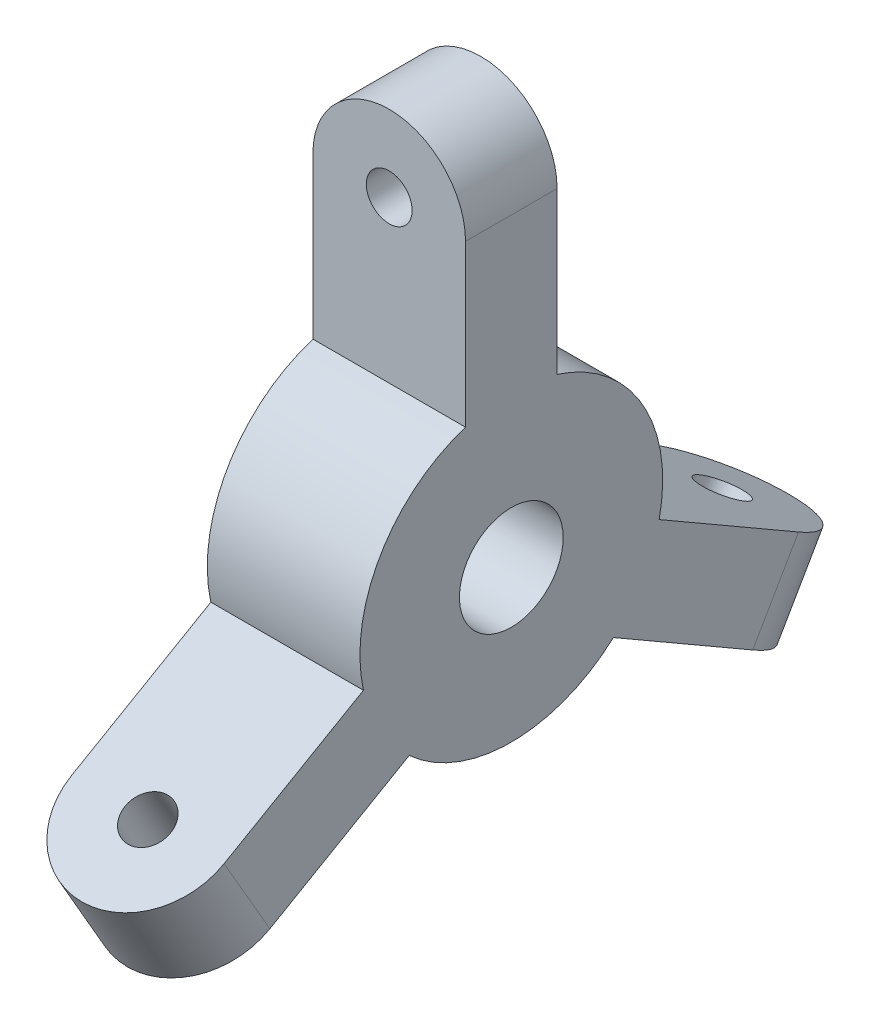
from build123d import *

# Parameters (mm, degrees)
BOSS_EXTRU_1_DEPTH           = 5
BOSS_EXTRU_1_DEPTH_BACK      = 5
TROU_TARAUD_M81_D            = 6.8
ESQUISSE5_R                  = 1.5
ENL_V_MAT_EXTRU_1_DEPTH      = 37.521989484
R_P_TITION_CIRCULAIRE1_COUNT = 3


with BuildPart() as part:
    # Esquisse1 → Boss.-Extru.1 (new, two sides: drawn at the far end of the back side and taken through both)
    with BuildSketch(Plane(origin=(0, 0, 0), x_dir=(0, 0, -1), z_dir=(1, 0, 0)).offset(-BOSS_EXTRU_1_DEPTH_BACK)):
        with BuildLine():
            Line((-3, 25), (3, 25))
            Line((3, 25), (3, 9.455495756))
            ThreePointArc((3, 9.455495756), (8.590972006, 4.96), (9.68869953, -2.129671667))
            Line((9.68869953, -2.129671667), (23.150635095, -9.901923789))
            Line((23.150635095, -9.901923789), (20.150635095, -15.098076211))
            Line((20.150635095, -15.098076211), (6.68869953, -7.32582409))
            ThreePointArc((6.68869953, -7.32582409), (0, -9.92), (-6.68869953, -7.32582409))
            Line((-6.68869953, -7.32582409), (-20.150635095, -15.098076211))
            Line((-20.150635095, -15.098076211), (-23.150635095, -9.901923789))
            Line((-23.150635095, -9.901923789), (-9.68869953, -2.129671667))
            ThreePointArc((-9.68869953, -2.129671667), (-8.590972006, 4.96), (-3, 9.455495756))
            Line((-3, 9.455495756), (-3, 25))
        make_face()
    extrude(amount=BOSS_EXTRU_1_DEPTH + BOSS_EXTRU_1_DEPTH_BACK)

    # Trou taraudé M81 (through all)
    with Locations(Plane(origin=(5, 0, 0), x_dir=(0, 0, -1), z_dir=(1, 0, 0))):
        with Locations((0, 0)):
            Hole(TROU_TARAUD_M81_D / 2)

    # Esquisse5 → Enlèv. mat.-Extru.1 (cut, through all)
    with BuildSketch(Plane.XY.offset(3)):
        with Locations((0, 20)):
            Circle(ESQUISSE5_R)
        with BuildLine():
            Line((-5, 9.455495756), (-5, 20))
            ThreePointArc((-5, 20), (0, 25), (5, 20))
            Line((5, 20), (5, 9.455495756))
            Line((5, 9.455495756), (13.62028311, 9.455495756))
            Line((13.62028311, 9.455495756), (13.62028311, 30))
            Line((13.62028311, 30), (-13.199246966, 30))
            Line((-13.199246966, 30), (-13.199246966, 9.455495756))
            Line((-13.199246966, 9.455495756), (-5, 9.455495756))
        make_face()
    enl_v_mat_extru_1 = extrude(amount=-ENL_V_MAT_EXTRU_1_DEPTH, mode=Mode.SUBTRACT)

    # Répétition circulaire1: Enlèv. mat.-Extru.1 ×3 about axis
    r_p_tition_circulaire1_axis = Axis((5, 0, 0), (1, 0, 0))
    for i in range(1, R_P_TITION_CIRCULAIRE1_COUNT):
        add(enl_v_mat_extru_1.rotate(r_p_tition_circulaire1_axis, i * 360 / R_P_TITION_CIRCULAIRE1_COUNT), mode=Mode.SUBTRACT)


solid = part.part
